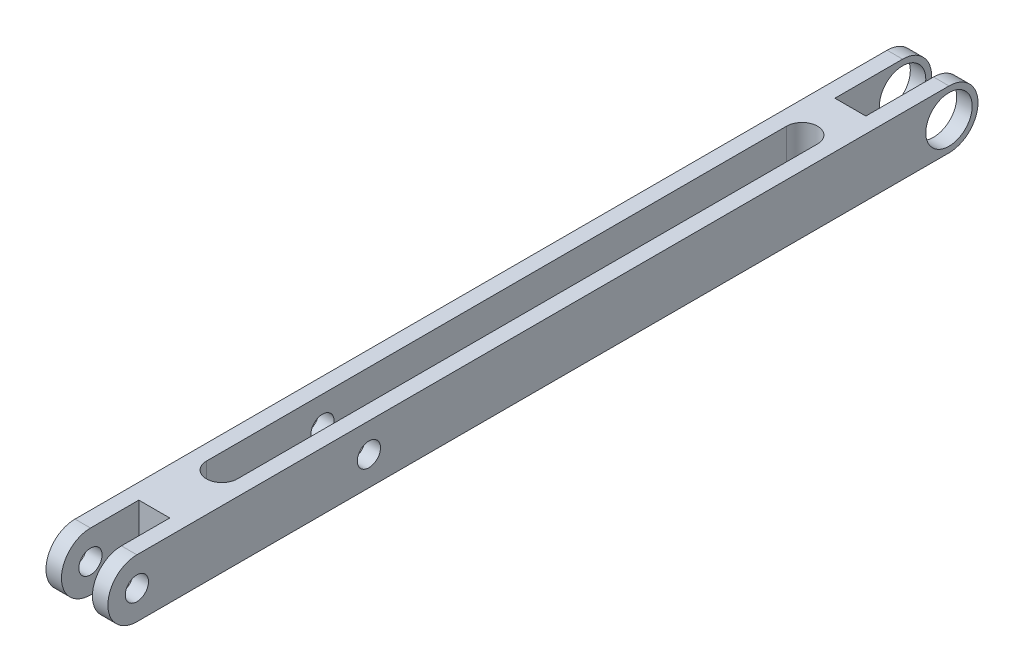
from build123d import *

# Parameters (mm, degrees)
EXTRUDE_1_DEPTH     = 16
SKETCH_3_W          = 8
SKETCH_3_H          = 20
SKETCH_3_H_2        = 25
CUT_EXTRUDE_1_DEPTH = 115.617843288
SKETCH_4_R          = 3
SKETCH_4_R_2        = 6
CUT_EXTRUDE_2_DEPTH = 114.879322091
CUT_EXTRUDE_3_DEPTH = 115.617843288
SKETCH_6_R          = 3
CUT_EXTRUDE_4_DEPTH = 114.879322091


with BuildPart() as part:
    # 草图2 → 凸台-拉伸1 (new body)
    with BuildSketch(Plane(origin=(0, 0, 0), x_dir=(0, 0, -1), z_dir=(1, 0, 0))):
        with BuildLine():
            Line((-105, -7.5), (105, -7.5))
            ThreePointArc((105, -7.5), (112.5, 0), (105, 7.5))
            Line((105, 7.5), (-105, 7.5))
            ThreePointArc((-105, 7.5), (-112.5, 0), (-105, -7.5))
        make_face()
    extrude(amount=EXTRUDE_1_DEPTH)

    # 草图3 → 切除-拉伸1 (cut, through all)
    with BuildSketch(Plane(origin=(0, 7.5, 0), x_dir=(1, 0, 0), z_dir=(0, 1, 0))):
        with Locations((8, -102.5)):
            Rectangle(SKETCH_3_W, SKETCH_3_H)
        with Locations((8, 100)):
            Rectangle(SKETCH_3_W, SKETCH_3_H_2)
    extrude(amount=-CUT_EXTRUDE_1_DEPTH, mode=Mode.SUBTRACT)

    # 草图4 → 切除-拉伸2 (cut, through all)
    with BuildSketch(Plane(origin=(16, 0, 0), x_dir=(0, 0, -1), z_dir=(1, 0, 0))):
        with Locations((-105, 0)):
            Circle(SKETCH_4_R)
        with Locations((105, 0)):
            Circle(SKETCH_4_R_2)
    extrude(amount=-CUT_EXTRUDE_2_DEPTH, mode=Mode.SUBTRACT)

    # 草图5 → 切除-拉伸3 (cut, through all)
    with BuildSketch(Plane.XZ.offset(7.5)):
        with BuildLine():
            Line((12, 75), (12, -75))
            ThreePointArc((12, -75), (8, -79), (4, -75))
            Line((4, -75), (4, 75))
            ThreePointArc((4, 75), (8, 79), (12, 75))
        make_face()
    extrude(amount=-CUT_EXTRUDE_3_DEPTH, mode=Mode.SUBTRACT)

    # 草图6 → 切除-拉伸4 (cut, through all)
    with BuildSketch(Plane.ZY):
        with Locations((45, 0)):
            Circle(SKETCH_6_R)
    extrude(amount=-CUT_EXTRUDE_4_DEPTH, mode=Mode.SUBTRACT)


solid = part.part
